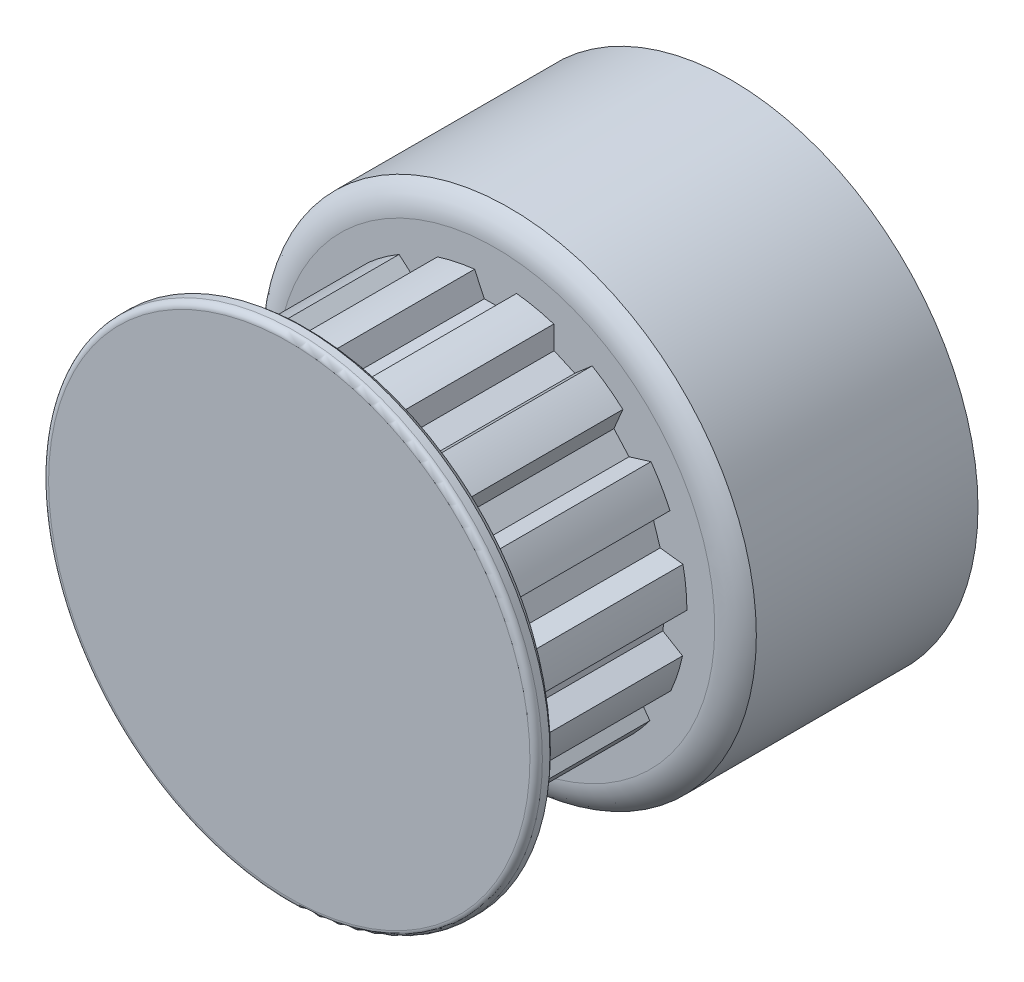
from build123d import *

# Parameters (mm, degrees)
CUT_EXTRUDE1_START  = 0.7366
CUT_EXTRUDE1_DEPTH  = 10.922
CIRPATTERN1_COUNT   = 15
FILLET1_R           = 0.381
SKETCH7_R           = 15.0876
BOSS_EXTRUDE1_DEPTH = 12.7
CUT_EXTRUDE3_DEPTH  = 12.7


# Read off the part's stored shape, not the designer's step: Split1
with BuildPart() as part:
    # Sketch2 → Revolve1 (revolve)
    with BuildSketch(Plane(origin=(0, 0, 0), x_dir=(0, 0, -1), z_dir=(1, 0, 0)), mode=Mode.PRIVATE) as revolve1_sk:
        with BuildLine():
            Line((-11.8745, 0), (11.8745, 0))
            Line((11.8745, 0), (11.8745, 15.0876))
            Line((11.8745, 15.0876), (11.02995, 15.0876))
            ThreePointArc((11.02995, 15.0876), (10.408190439, 14.337674152), (10.1854, 13.389339743))
            Line((10.1854, 13.389339743), (10.1854, 11.691079486))
            Line((10.1854, 11.691079486), (-0.7366, 11.691079486))
            Line((-0.7366, 11.691079486), (-0.7366, 13.389339743))
            ThreePointArc((-0.7366, 13.389339743), (-0.959390439, 14.337674152), (-1.58115, 15.0876))
            Line((-1.58115, 15.0876), (-2.4257, 15.0876))
            Line((-2.4257, 15.0876), (-2.4257, 7.9375))
            Line((-2.4257, 7.9375), (-11.8745, 7.9375))
            Line((-11.8745, 7.9375), (-11.8745, 0))
        make_face()
    revolve(revolve1_sk.sketch.rotate(Axis((0, 0, 11.8745), (0, 0, -1)), 90), axis=Axis((0, 0, 11.8745), (0, 0, -1)))

    # Sketch3 → Cut-Extrude1 (cut)
    with BuildSketch(Plane.XY.offset(CUT_EXTRUDE1_START)):
        with BuildLine():
            Line((-0.690489274, 10.3505), (0.690489274, 10.3505))
            Line((0.690489274, 10.3505), (1.2827, 11.6205))
            ThreePointArc((1.2827, 11.6205), (0, 11.691079486), (-1.2827, 11.6205))
            Line((-1.2827, 11.6205), (-0.690489274, 10.3505))
        make_face()
    cut_extrude1 = extrude(amount=-CUT_EXTRUDE1_DEPTH, mode=Mode.SUBTRACT)

    # CirPattern1: Cut-Extrude1 ×15 about axis
    cirpattern1_axis = Axis((0, 0, 0), (0, 0, 1))
    for i in range(1, CIRPATTERN1_COUNT):
        add(cut_extrude1.rotate(cirpattern1_axis, i * 360 / CIRPATTERN1_COUNT), mode=Mode.SUBTRACT)


with BuildPart() as body_2:
    # Split1: the piece on the far side of the plane
    add(part.part)
    split(bisect_by=Plane.XY.offset(2.4257), keep=Keep.BOTTOM)

    # Fillet1
    fillet1_edges = [body_2.edges().sort_by_distance(p)[0] for p in [
        (-15.0876, 0, 2.4257),
    ]]
    fillet(fillet1_edges, radius=FILLET1_R)

    # Sketch7 → Boss-Extrude1 (add)
    with BuildSketch(Plane(origin=(0, 0, -11.8745), x_dir=(-1, 0, 0), z_dir=(0, 0, -1))):
        with Locations(Location((0, 0, 0), (0, 0, 180))):
            Circle(SKETCH7_R)
    extrude(amount=BOSS_EXTRUDE1_DEPTH)

    # Sketch6 → Cut-Extrude3 (cut)
    with BuildSketch(Plane(origin=(0, 0, -11.8745), x_dir=(-1, 0, 0), z_dir=(0, 0, -1))):
        Polygon((-12, 6.92820323), (-12, -6.92820323), (0, -13.856406461), (12, -6.92820323), (12, 6.92820323), (0, 13.856406461), align=None)
    extrude(amount=CUT_EXTRUDE3_DEPTH, mode=Mode.SUBTRACT)


with BuildPart() as part_1:
    add(part.part)

    # Split1
    split(bisect_by=Plane.XY.offset(2.4257), keep=Keep.TOP)


solid = body_2.part
